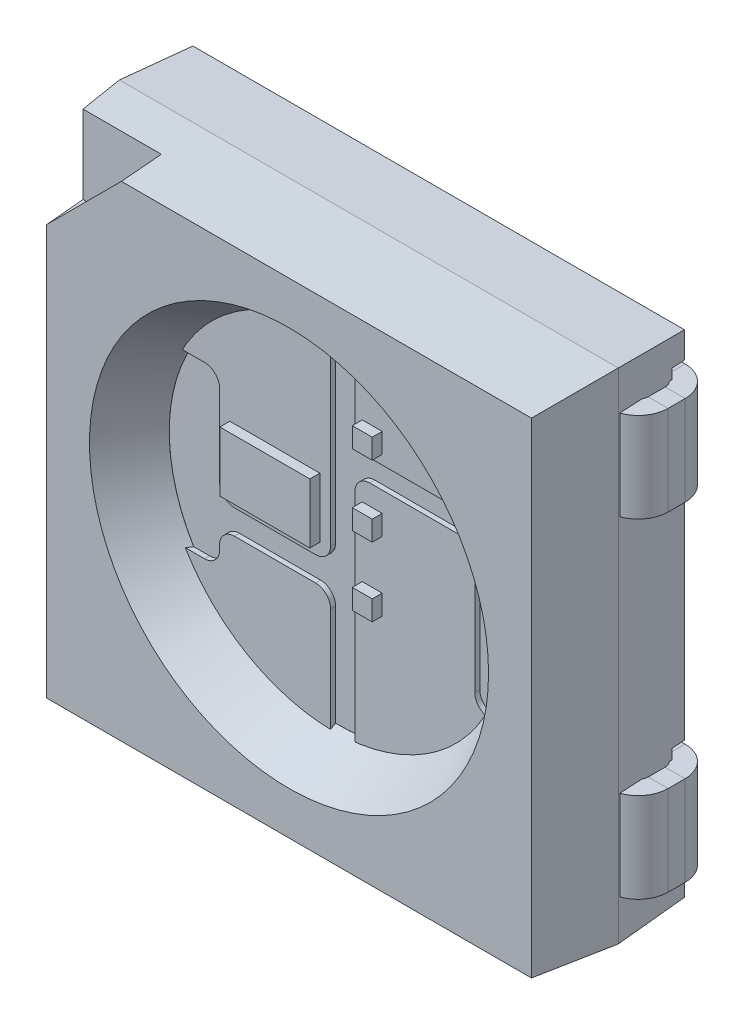
from build123d import *

# Parameters (mm, degrees)
SKETCH_1_W                       = 5
SKETCH_1_H                       = 5
EXTRUDE_1_DEPTH                  = 0.7
EXTRUDE_1_DRAFT                  = -3
SKETCH_3_R                       = 0.55
SKETCH_3_W                       = 1.424481166
SKETCH_3_H                       = 1.1
SKETCH_3_W_2                     = 1.1
SKETCH_3_H_2                     = 1.20483499
SKETCH_3_H_3                     = 1.190667693
SKETCH_3_W_3                     = 1.035065358
SKETCH_3_W_4                     = 1.548034511
CUT_EXTRUDE_1_DEPTH              = 0.13
SKETCH_5_W                       = 0.8
SKETCH_5_H                       = 0.9
SM_BASE_FLANGE_1_DEPTH           = 0.2
SM_EDGE_FLANGE_1_STRIP_W         = 1
SM_EDGE_FLANGE_1_STRIP_H         = 0.2
SM_EDGE_FLANGE_1_STRIP_CUT_DEPTH = 0.9
SM_EDGE_FLANGE_1_DEPTH           = 0.9
SM_EDGE_FLANGE_2_STRIP_W         = 1
SM_EDGE_FLANGE_2_STRIP_H         = 0.2
SM_EDGE_FLANGE_2_STRIP_CUT_DEPTH = 0.9
SM_EDGE_FLANGE_2_DEPTH           = 0.9
PATTERN_LINEAR_1_COUNT           = 2
PATTERN_LINEAR_1_PITCH           = 3.3
SKETCH_30_W                      = 5
SKETCH_30_H                      = 5
EXTRUDE_3_DEPTH                  = 0.8
EXTRUDE_3_TAPER                  = 5
CUT_EXTRUDE_2_DEPTH              = 0.4
SKETCH_34_R                      = 1.7
CUT_EXTRUDE_3_DEPTH              = 0.5
CHAMFER_1_SIZE                   = 0.3
CHAMFER_1_SIZE2                  = 0.499283845
EXTRUDE_4_DEPTH                  = 0.05
EXTRUDE_4_2_DEPTH                = 0.05
EXTRUDE_4_3_DEPTH                = 0.05
EXTRUDE_4_4_DEPTH                = 0.05
SKETCH_49_W                      = 0.902111922
SKETCH_49_H                      = 0.599755728
EXTRUDE_5_DEPTH                  = 0.1
SKETCH_49_W_2                    = 0.2
SKETCH_49_H_2                    = 0.2
EXTRUDE_5_2_DEPTH                = 0.1
EXTRUDE_5_3_DEPTH                = 0.1
EXTRUDE_5_4_DEPTH                = 0.1


# Sheet-metal steps are written as plain solids
with BuildPart() as part:
    # Sketch 1 → Бобышка-Вытянуть1 (with draft: the straight prism first)
    with BuildSketch(Plane.XY):
        Rectangle(SKETCH_1_W, SKETCH_1_H)
    extrude(amount=-EXTRUDE_1_DEPTH)
    # Бобышка-Вытянуть1: the draft: its side faces are tilted about the plane it starts from
    extrude_1_sides = [part.faces().sort_by_distance(p)[0] for p in [
        (-2.5, 0, -0.35),
        (0, -2.5, -0.35),
        (2.5, 0, -0.35),
        (0, 2.5, -0.35),
    ]]
    draft(extrude_1_sides, Plane.XY, EXTRUDE_1_DRAFT)

    # Sketch 3 → Вырез-Вытянуть1 (cut)
    with BuildSketch(Plane(origin=(0, 0, -0.7), x_dir=(-1, 0, 0), z_dir=(0, 0, -1))):
        Circle(SKETCH_3_R)
        with Locations((-2.312240583, 1.65)):
            Rectangle(SKETCH_3_W, SKETCH_3_H)
        with Locations((0, 1.652417495)):
            Rectangle(SKETCH_3_W_2, SKETCH_3_H_2)
        with Locations((0, -1.645333847)):
            Rectangle(SKETCH_3_W_2, SKETCH_3_H_3)
        with Locations((2.117532679, 1.65)):
            Rectangle(SKETCH_3_W_3, SKETCH_3_H)
        with Locations((-2.374017256, -1.65)):
            Rectangle(SKETCH_3_W_4, SKETCH_3_H)
        with Locations((2.117532679, -1.65)):
            Rectangle(SKETCH_3_W_3, SKETCH_3_H)
    extrude(amount=-CUT_EXTRUDE_1_DEPTH, mode=Mode.SUBTRACT)



with BuildPart() as body_2:
    # Sketch 5 → Базовая кромка1 (new body)
    with BuildSketch(Plane(origin=(0, 0, -0.57), x_dir=(-1, 0, 0), z_dir=(0, 0, -1))):
        with Locations((-2.1, 1.65)):
            Rectangle(SKETCH_5_W, SKETCH_5_H)
    extrude(amount=SM_BASE_FLANGE_1_DEPTH)

    # Ребро-кромка1 strip (across the edge) → Ребро-кромка1 strip cut (cut)
    with BuildSketch(Plane(origin=(2.5, 1.2, -0.57), x_dir=(-1, 0, 0), z_dir=(0, 1, 0))):
        with Locations((-0.4, -0.1)):
            Rectangle(SM_EDGE_FLANGE_1_STRIP_W, SM_EDGE_FLANGE_1_STRIP_H)
    extrude(amount=SM_EDGE_FLANGE_1_STRIP_CUT_DEPTH, mode=Mode.SUBTRACT)

    # Ребро-кромка1 section (across the edge) → Ребро-кромка1 (add)
    with BuildSketch(Plane(origin=(2.5, 1.2, -0.57), x_dir=(-1, 0, 0), z_dir=(0, 1, 0))):
        with BuildLine():
            Line((-0.2, 0.1), (-0.2, 0.57))
            Line((-0.2, 0.57), (0, 0.57))
            Line((0, 0.57), (0, 0.1))
            ThreePointArc((0, 0.1), (0.029289322, 0.029289322), (0.1, 0))
            Line((0.1, 0), (0.1, -0.2))
            ThreePointArc((0.1, -0.2), (-0.112132034, -0.112132034), (-0.2, 0.1))
        make_face()
    extrude(amount=SM_EDGE_FLANGE_1_DEPTH)

    # Ребро-кромка2 strip (across the edge) → Ребро-кромка2 strip cut (cut)
    with BuildSketch(Plane(origin=(2.5, 1.2, 0), x_dir=(0, 0, -1), z_dir=(0, 1, 0))):
        with Locations((-0.2, -0.1)):
            Rectangle(SM_EDGE_FLANGE_2_STRIP_W, SM_EDGE_FLANGE_2_STRIP_H)
    extrude(amount=SM_EDGE_FLANGE_2_STRIP_CUT_DEPTH, mode=Mode.SUBTRACT)

    # Ребро-кромка2 section (across the edge) → Ребро-кромка2 (add)
    with BuildSketch(Plane(origin=(2.5, 1.2, 0), x_dir=(0, 0, -1), z_dir=(0, 1, 0))):
        with BuildLine():
            Line((0, 0.1), (0, 0.4))
            Line((0, 0.4), (0.2, 0.4))
            Line((0.2, 0.4), (0.2, 0.1))
            ThreePointArc((0.2, 0.1), (0.229289322, 0.029289322), (0.3, 0))
            Line((0.3, 0), (0.3, -0.2))
            ThreePointArc((0.3, -0.2), (0.087867966, -0.112132034), (0, 0.1))
        make_face()
    extrude(amount=SM_EDGE_FLANGE_2_DEPTH)


with BuildPart() as pattern_linear_1_1:
    # Линейный массив1: pattern copy
    add(body_2.part.moved(Location(Vector(0, -1, 0) * (1 * PATTERN_LINEAR_1_PITCH))))


with BuildPart() as body_4:
    # Зеркальное отражение1: mirrored copy
    add(body_2.part.mirror(Plane(origin=(0, 0, 0), x_dir=(0, 0, 1), z_dir=(1, 0, 0))))


with BuildPart() as body_5:
    # Mirror 1 2: mirrored copy
    add(pattern_linear_1_1.part.mirror(Plane(origin=(0, 0, 0), x_dir=(0, 0, 1), z_dir=(1, 0, 0))))


with BuildPart() as part_1:
    add(part.part)

    add(body_2.part)  # Бобышка-Вытянуть3 merges body 2

    add(pattern_linear_1_1.part)  # Бобышка-Вытянуть3 merges Линейный массив1_1

    add(body_4.part)  # Бобышка-Вытянуть3 merges body 4

    add(body_5.part)  # Бобышка-Вытянуть3 merges body 5
    # Эскиз30 → Бобышка-Вытянуть3 (add)
    with BuildSketch(Plane.XY):
        Rectangle(SKETCH_30_W, SKETCH_30_H)
    extrude(amount=EXTRUDE_3_DEPTH, taper=EXTRUDE_3_TAPER)

    # Эскиз33 → Вырез-Вытянуть2 (cut)
    with BuildSketch(Plane.XY.offset(0.8)):
        Polygon((-1.680009069, 2.430009069), (-2.430009069, 1.680009069), (-2.879687624, 1.680009069), (-2.879687624, 2.879687624), (-1.680009069, 2.879687624), align=None)
    extrude(amount=-CUT_EXTRUDE_2_DEPTH, mode=Mode.SUBTRACT)

    # Эскиз34 → Вырез-Вытянуть3 (cut)
    with BuildSketch(Plane.XY.offset(0.8)):
        Circle(SKETCH_34_R)
    extrude(amount=-CUT_EXTRUDE_3_DEPTH, mode=Mode.SUBTRACT)

    # Фаска1
    chamfer_1_edges = [part_1.edges().sort_by_distance(p)[0] for p in [
        (-1.7, 0, 0.8),
    ]]
    chamfer_1_side = [part_1.faces().sort_by_distance(p)[0] for p in [
        (0, -2.361278034, 0.8),
    ]]
    chamfer(chamfer_1_edges, length=CHAMFER_1_SIZE, length2=CHAMFER_1_SIZE2, reference=chamfer_1_side[0])


with BuildPart() as body_2_2:
    # Эскиз48 → Бобышка-Вытянуть4 (new body)
    with BuildSketch(Plane.XY.offset(0.3)):
        with BuildLine():
            Line((0.210318716, -2.05695293), (0.210318716, 0.457058905))
            ThreePointArc((0.210318716, 0.457058905), (0.254252699, 0.563124922), (0.360318716, 0.607058905))
            Line((0.360318716, 0.607058905), (1.262305442, 0.607058905))
            ThreePointArc((1.262305442, 0.607058905), (1.36837146, 0.563124922), (1.412305442, 0.457058905))
            Line((1.412305442, 0.457058905), (1.412305442, -0.686015987))
            ThreePointArc((1.412305442, -0.686015987), (1.456239425, -0.792082004), (1.562305442, -0.836015987))
            Line((1.562305442, -0.836015987), (1.930905545, -0.836015987))
            Line((1.930905545, -0.836015987), (1.930905545, -2.05695293))
            Line((1.930905545, -2.05695293), (0.210318716, -2.05695293))
        make_face()
    extrude(amount=EXTRUDE_4_DEPTH)


with BuildPart() as body_3:
    # Эскиз48 → Extrude 4 2 (new body)
    with BuildSketch(Plane.XY.offset(0.3)):
        with BuildLine():
            Line((0.210318716, 2.110000815), (1.930905545, 2.110000815))
            Line((1.930905545, 2.110000815), (1.930905545, 0.825125098))
            Line((1.930905545, 0.825125098), (0.360318716, 0.825125098))
            ThreePointArc((0.360318716, 0.825125098), (0.254252699, 0.869059081), (0.210318716, 0.975125098))
            Line((0.210318716, 0.975125098), (0.210318716, 2.110000815))
        make_face()
    extrude(amount=EXTRUDE_4_2_DEPTH)


with BuildPart() as body_4_2:
    # Эскиз48 → Extrude 4 3 (new body)
    with BuildSketch(Plane.XY.offset(0.3)):
        with BuildLine():
            Line((-0.033165046, -2.05695293), (-0.033165046, -0.683219524))
            ThreePointArc((-0.033165046, -0.683219524), (-0.077099029, -0.577153506), (-0.183165046, -0.533219524))
            Line((-0.183165046, -0.533219524), (-0.996028626, -0.533219524))
            ThreePointArc((-0.996028626, -0.533219524), (-1.102094643, -0.577153506), (-1.146028626, -0.683219524))
            Line((-1.146028626, -0.683219524), (-1.146028626, -0.728739244))
            ThreePointArc((-1.146028626, -0.728739244), (-1.189962609, -0.834805261), (-1.296028626, -0.878739244))
            Line((-1.296028626, -0.878739244), (-1.919276728, -0.878739244))
            Line((-1.919276728, -0.878739244), (-1.919276728, -2.05695293))
            Line((-1.919276728, -2.05695293), (-0.033165046, -2.05695293))
        make_face()
    extrude(amount=EXTRUDE_4_3_DEPTH)


with BuildPart() as body_5_2:
    # Эскиз48 → Extrude 4 4 (new body)
    with BuildSketch(Plane.XY.offset(0.3)):
        with BuildLine():
            Line((-0.033165046, 2.110000815), (-1.971607025, 2.110000815))
            Line((-1.971607025, 2.110000815), (-1.971607025, 0.825125098))
            Line((-1.971607025, 0.825125098), (-1.296028626, 0.825125098))
            ThreePointArc((-1.296028626, 0.825125098), (-1.189962609, 0.781191115), (-1.146028626, 0.675125098))
            Line((-1.146028626, 0.675125098), (-1.146028626, -0.137005614))
            ThreePointArc((-1.146028626, -0.137005614), (-1.102094643, -0.243071632), (-0.996028626, -0.287005614))
            Line((-0.996028626, -0.287005614), (-0.183165046, -0.287005614))
            ThreePointArc((-0.183165046, -0.287005614), (-0.077099029, -0.243071632), (-0.033165046, -0.137005614))
            Line((-0.033165046, -0.137005614), (-0.033165046, 2.110000815))
        make_face()
    extrude(amount=EXTRUDE_4_4_DEPTH)


with BuildPart() as body_6:
    # Эскиз49 → Бобышка-Вытянуть5 (new body)
    with BuildSketch(Plane.XY.offset(0.35)):
        with Locations((-0.592641639, 0.141472266)):
            Rectangle(SKETCH_49_W, SKETCH_49_H)
    extrude(amount=EXTRUDE_5_DEPTH)


with BuildPart() as body_7:
    # Эскиз49 → Extrude 5 2 (new body)
    with BuildSketch(Plane.XY.offset(0.35)):
        with Locations((0.383820167, 1.016322564)):
            Rectangle(SKETCH_49_W_2, SKETCH_49_H_2)
    extrude(amount=EXTRUDE_5_2_DEPTH)


with BuildPart() as body_8:
    # Эскиз49 → Extrude 5 3 (new body)
    with BuildSketch(Plane.XY.offset(0.35)):
        with Locations((0.383820167, 0.304674762)):
            Rectangle(SKETCH_49_W_2, SKETCH_49_H_2)
    extrude(amount=EXTRUDE_5_3_DEPTH)


with BuildPart() as body_9:
    # Эскиз49 → Extrude 5 4 (new body)
    with BuildSketch(Plane.XY.offset(0.35)):
        with Locations((0.383820167, -0.387189749)):
            Rectangle(SKETCH_49_W_2, SKETCH_49_H_2)
    extrude(amount=EXTRUDE_5_4_DEPTH)


solid = Compound([part_1.part, body_2_2.part, body_3.part, body_4_2.part, body_5_2.part, body_6.part, body_7.part, body_8.part, body_9.part])
